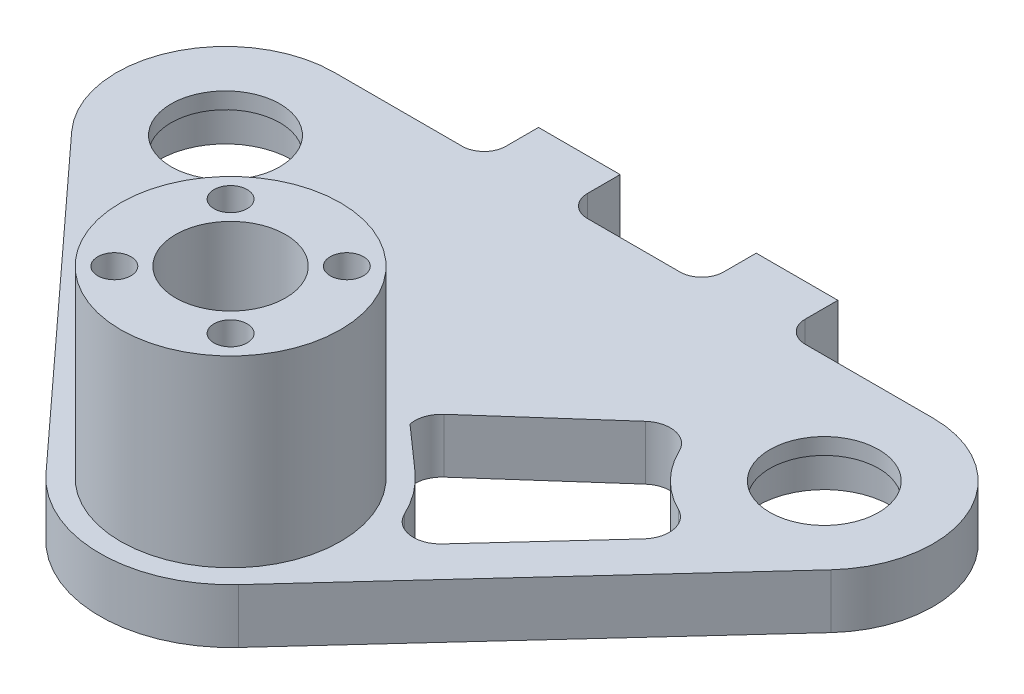
from build123d import *

# Parameters (mm, degrees)
SKETCH1_R              = 10.1
SKETCH1_R_2            = 10
MAIN_BODY_DEPTH        = 10
SKETCH2_R              = 12.2
BEARING_RECESS_DEPTH   = 7
STANDOFF_START         = 1.5
SKETCH3_R              = 21.5
SKETCH3_R_2            = 10.1
STANDOFF_SECTION_DEPTH = 1.5
SKETCH9_R              = 20.2
SKETCH9_R_2            = 10.1
BOSS_EXTRUDE1_DEPTH    = 33.7
EXTRA_GEOMETRY_DEPTH   = 10
SKETCH8_R              = 2
CUT_EXTRUDE1_DEPTH     = 6
SKETCH4_R              = 3.05
M6_BOLT_HOLES_DEPTH    = 122.389206984


with BuildPart() as part:
    # Sketch1 → Main Body (new body)
    with BuildSketch(Plane(origin=(0, 0, 0), x_dir=(1, 0, 0), z_dir=(0, 1, 0))):
        with BuildLine():
            Line((-69.741518057, 40.551033083), (-17.689821668, -16.219439242))
            ThreePointArc((-17.689821668, -16.219439242), (17.115072934, -16.824811395), (15.914514265, 17.96463848))
            Line((15.914514265, 17.96463848), (-41.737904779, 69.037764518))
            ThreePointArc((-41.737904779, 69.037764518), (-69.262560778, 68.087908614), (-69.741518057, 40.551033083))
        make_face()
        Circle(SKETCH1_R, mode=Mode.SUBTRACT)
        with Locations((-55, 54.067232452)):
            Circle(SKETCH1_R_2, mode=Mode.SUBTRACT)
        with BuildLine():
            Line((-47.625471592, 28.267691162), (-29.927098797, 8.964862385))
            ThreePointArc((-29.927098797, 8.964862385), (-25.488644513, 7.400949716), (-21.717284924, 10.215651499))
            ThreePointArc((-21.717284924, 10.215651499), (-17.115072934, 16.824811395), (-10.585592312, 21.539388))
            ThreePointArc((-10.585592312, 21.539388), (-7.835804554, 25.358336357), (-9.475400239, 29.769393516))
            Line((-9.475400239, 29.769393516), (-29.078104388, 47.135037426))
            ThreePointArc((-29.078104388, 47.135037426), (-33.398420323, 48.290403264), (-36.914902554, 45.527370018))
            ThreePointArc((-36.914902554, 45.527370018), (-40.737439222, 40.046556289), (-46.152073662, 36.130839294))
            ThreePointArc((-46.152073662, 36.130839294), (-48.85455966, 32.56761471), (-47.625471592, 28.267691162))
        make_face(mode=Mode.SUBTRACT)
    extrude(amount=MAIN_BODY_DEPTH)

    # Sketch2 → Bearing Recess (cut)
    with BuildSketch(Plane.XZ):
        with Locations((-55, -54.067232452)):
            Circle(SKETCH2_R)
    extrude(amount=-BEARING_RECESS_DEPTH, mode=Mode.SUBTRACT)

    # Sketch3 → Standoff Section (add)
    with BuildSketch(Plane.XZ.offset(STANDOFF_START)):
        Circle(SKETCH3_R)
        Circle(SKETCH3_R_2, mode=Mode.SUBTRACT)
    extrude(amount=-STANDOFF_SECTION_DEPTH)

    # Sketch9 → Boss-Extrude1 (add)
    with BuildSketch(Plane(origin=(0, 10, 0), x_dir=(1, 0, 0), z_dir=(0, 1, 0))):
        Circle(SKETCH9_R)
        Circle(SKETCH9_R_2, mode=Mode.SUBTRACT)
    extrude(amount=BOSS_EXTRUDE1_DEPTH)

    # Sketch6 → Extra Geometry (add)
    with BuildSketch(Plane(origin=(0, 0, 0), x_dir=(1, 0, 0), z_dir=(0, 1, 0))):
        with BuildLine():
            Line((0, 74.067232452), (0, 32.062988668))
            Line((0, 32.062988668), (-41.737904779, 69.037764518))
            ThreePointArc((-41.737904779, 69.037764518), (-47.908125823, 72.767642091), (-55, 74.067232452))
            Line((-55, 74.067232452), (-31.5, 74.067232452))
            ThreePointArc((-31.5, 74.067232452), (-28.671572875, 75.238805327), (-27.5, 78.067232452))
            Line((-27.5, 78.067232452), (-27.5, 84.067232452))
            Line((-27.5, 84.067232452), (-12.5, 84.067232452))
            Line((-12.5, 84.067232452), (-12.5, 78.067232452))
            ThreePointArc((-12.5, 78.067232452), (-11.328427125, 75.238805327), (-8.5, 74.067232452))
            Line((-8.5, 74.067232452), (0, 74.067232452))
        make_face()
    extrude(amount=EXTRA_GEOMETRY_DEPTH)

    # Sketch8 → Cut-Extrude1 (cut)
    with BuildSketch(Plane(origin=(0, 0, -84.067232452), x_dir=(-1, 0, 0), z_dir=(0, 0, -1))):
        with Locations((20, 5)):
            Circle(SKETCH8_R)
    extrude(amount=-CUT_EXTRUDE1_DEPTH, mode=Mode.SUBTRACT)

    # Mirror2: part across plane


with BuildPart() as part_1:
    add(part.part)
    add(part.part.mirror(Plane(origin=(0, 0, 0), x_dir=(0, 0, 1), z_dir=(1, 0, 0))))

    # Sketch4 → M6 Bolt holes (cut, through all)
    with BuildSketch(Plane.XZ.offset(1.5)):
        with Locations((-10.677312396, 10.677312396)):
            Circle(SKETCH4_R)
        with Locations((10.677312396, 10.677312396)):
            Circle(SKETCH4_R)
        with Locations((10.677312396, -10.677312396)):
            Circle(SKETCH4_R)
        with Locations((-10.677312396, -10.677312396)):
            Circle(SKETCH4_R)
    extrude(amount=-M6_BOLT_HOLES_DEPTH, mode=Mode.SUBTRACT)


solid = part_1.part
